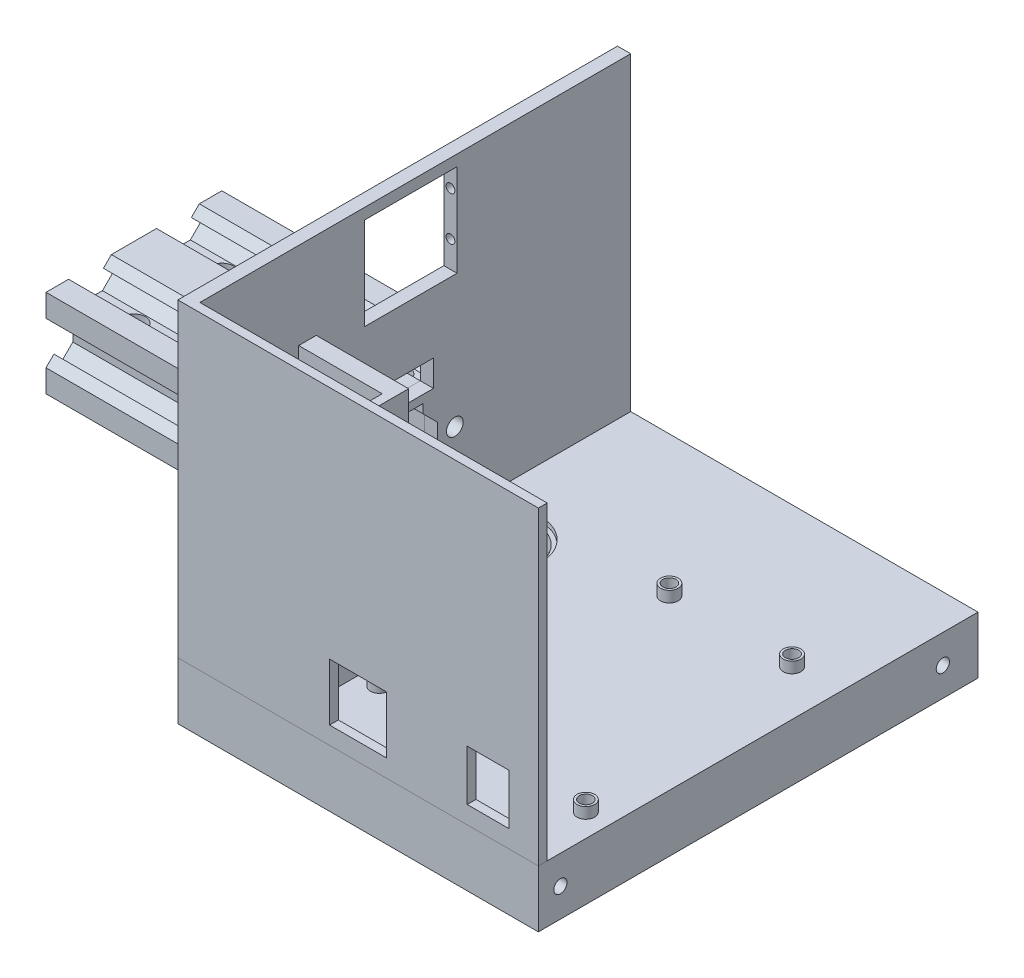
from build123d import *
from build123d.topology import SkipClean

# Parameters (mm, degrees)
SKETCH1_W                 = 60
SKETCH1_H                 = 40
BOSS_EXTRUDE1_DEPTH       = 20
SKETCH7_R                 = 1.9
CUT_EXTRUDE13_DEPTH       = 67.332495807
SKETCH16_R                = 2.6
CUT_EXTRUDE11_DEPTH       = 39.642075514
SKETCH17_W                = 100
SKETCH17_H                = 43.5
SKETCH17_H_2              = 40
BOSS_EXTRUDE2_DEPTH       = 82
SKETCH18_W                = 79
SKETCH18_H                = 98
CUT_EXTRUDE14_DEPTH       = 70.5
CUT_EXTRUDE15_REACH       = 117.136
SKETCH7_6_R               = 1.9
CUT_EXTRUDE16_REACH       = 117.136
SKETCH20_W                = 10.268679656
SKETCH20_H                = 6
CUT_EXTRUDE17_REACH       = 117.136
SKETCH22_W                = 21
SKETCH22_H                = 21
SKETCH23_R                = 1
CUT_EXTRUDE18_DEPTH       = 5
SKETCH26_W                = 26.48
SKETCH26_H                = 50.768519815
BOSS_EXTRUDE3_DEPTH       = 21
SKETCH27_W                = 19
SKETCH27_H                = 22.48
CUT_EXTRUDE19_DEPTH       = 50.768519815
CUT_EXTRUDE20_REACH       = 149.28
SKETCH30_W                = 12
SKETCH30_H                = 23.5
SKETCH30_R                = 1.5
CUT_EXTRUDE21_START       = -12
CUT_EXTRUDE21_OUTLINE_R   = 1.5
CUT_EXTRUDE21_DEPTH       = 5
SKETCH35_W                = 13
SKETCH35_H                = 13
SKETCH35_W_2              = 9.5
SKETCH35_H_2              = 11.5
CUT_EXTRUDE23_DEPTH       = 162.803121107
SKETCH45_R                = 8.1
CUT_EXTRUDE24_DEPTH       = 142.471728624
SKETCH46_R                = 9.05
CUT_EXTRUDE25_DEPTH       = 1
CUT_EXTRUDE26_START       = -9
CUT_EXTRUDE26_DEPTH       = 9
BOSS_EXTRUDE5_DEPTH       = 9
CUT_EXTRUDE27_REACH       = 118.569
SKETCH50_W                = 8.5
SKETCH50_H                = 3.5
SKETCH51_R                = 1.5
CUT_EXTRUDE28_DEPTH       = 5
SKETCH52_R                = 1.5
CUT_EXTRUDE29_DEPTH       = 5
BOSS_EXTRUDE4_START       = -7
BOSS_EXTRUDE4_OUTLINE_R   = 2
BOSS_EXTRUDE4_OUTLINE_R_2 = 1.5
BOSS_EXTRUDE4_DEPTH       = 2.5


# Read off the part's stored shape, not the designer's step: Cut-Extrude21, Boss-Extrude4
with BuildPart() as part:
    # Sketch1 → Boss-Extrude1 (new body)
    with BuildSketch(Plane(origin=(0, 0, 0), x_dir=(1, 0, 0), z_dir=(0, 1, 0))):
        Rectangle(SKETCH1_W, SKETCH1_H)
    extrude(amount=BOSS_EXTRUDE1_DEPTH)

    # Sketch7 → Cut-Extrude13 (cut, through all)
    with BuildSketch(Plane(origin=(30, 0, 0), x_dir=(0, 0, -1), z_dir=(1, 0, 0))):
        Polygon((-12.839339828, 13.9), (-7.159339828, 13.9), (-4.499339828, 16.56), (-4.499339828, 18.2), (-6.934339828, 18.2), (-5.134339828, 20), (-14.864339828, 20), (-13.064339828, 18.2), (-15.499339828, 18.2), (-15.499339828, 16.56), align=None)
        Polygon((-18.2, 13.064339828), (-20, 14.864339828), (-20, 5.134339828), (-18.2, 6.934339828), (-18.2, 4.499339828), (-16.56, 4.499339828), (-13.9, 7.159339828), (-13.9, 12.839339828), (-16.56, 15.499339828), (-18.2, 15.499339828), align=None)
        Polygon((-13.064339828, 1.798679656), (-14.863019485, 0), (-5.135660172, 0), (-6.934339828, 1.798679656), (-4.499339828, 1.798679656), (-4.499339828, 3.438679656), (-7.159339828, 6.098679656), (-12.839339828, 6.098679656), (-15.499339828, 3.438679656), (-15.499339828, 1.798679656), align=None)
        Polygon((6.098679656, 12.839339828), (6.098679656, 7.159339828), (2.73, 3.790660172), (2.73, 1.798679656), (-2.73, 1.798679656), (-2.73, 3.790660172), (-6.098679656, 7.159339828), (-6.098679656, 12.839339828), (-2.73, 16.208019485), (-2.73, 18.2), (2.73, 18.2), (2.73, 16.208019485), align=None)
        Polygon((5.135660172, 0), (14.863019485, 0), (13.064339828, 1.798679656), (15.499339828, 1.798679656), (15.499339828, 3.438679656), (12.839339828, 6.098679656), (7.159339828, 6.098679656), (4.499339828, 3.438679656), (4.499339828, 1.798679656), (6.934339828, 1.798679656), align=None)
        Polygon((20, 5.134339828), (20, 14.864339828), (18.2, 13.064339828), (18.2, 15.499339828), (16.56, 15.499339828), (13.9, 12.839339828), (13.9, 7.159339828), (16.56, 4.499339828), (18.2, 4.499339828), (18.2, 6.934339828), align=None)
        Polygon((14.864339828, 20), (5.134339828, 20), (6.934339828, 18.2), (4.499339828, 18.2), (4.499339828, 16.56), (7.159339828, 13.9), (12.839339828, 13.9), (15.499339828, 16.56), (15.499339828, 18.2), (13.064339828, 18.2), align=None)
        with Locations((-10, 10)):
            Circle(SKETCH7_R)
        with Locations((10, 10)):
            Circle(SKETCH7_R)
    extrude(amount=-CUT_EXTRUDE13_DEPTH, mode=Mode.SUBTRACT)

    # Sketch16 → Cut-Extrude11 (cut, through all)
    with BuildSketch(Plane(origin=(0, 13.9, 0), x_dir=(1, 0, 0), z_dir=(0, 1, 0))):
        with Locations(Location((20, -9.999339828, 0), (0, 0, 270))):
            Circle(SKETCH16_R)
        with Locations(Location((20, 9.999339828, 0), (0, 0, 270))):
            Circle(SKETCH16_R)
    cut_extrude11 = extrude(amount=-CUT_EXTRUDE11_DEPTH, mode=Mode.SUBTRACT)

    # Mirror1: Cut-Extrude11 across plane
    add(cut_extrude11.mirror(Plane.ZY), mode=Mode.SUBTRACT)

    # Sketch17 → Boss-Extrude2 (add)
    with BuildSketch(Plane(origin=(30, 0, 0), x_dir=(0, 0, -1), z_dir=(1, 0, 0))):
        with Locations((0, 41.75)):
            Rectangle(SKETCH17_W, SKETCH17_H)
        Rectangle(SKETCH17_W, SKETCH17_H_2)
    extrude(amount=BOSS_EXTRUDE2_DEPTH)

    # Sketch18 → Cut-Extrude14 (cut)
    with BuildSketch(Plane(origin=(0, 63.5, 0), x_dir=(1, 0, 0), z_dir=(0, 1, 0))):
        with Locations((72.5, 1)):
            Rectangle(SKETCH18_W, SKETCH18_H)
    extrude(amount=-CUT_EXTRUDE14_DEPTH, mode=Mode.SUBTRACT)

    # Sketch7<6> → Cut-Extrude15 (cut, up to next)
    with BuildSketch(Plane(origin=(30, 0, 0), x_dir=(0, 0, -1), z_dir=(1, 0, 0)), mode=Mode.PRIVATE) as cut_extrude15_sk1:
        Polygon((6.098679656, 12.839339828), (6.098679656, 7.159339828), (2.73, 3.790660172), (2.73, 1.798679656), (-2.73, 1.798679656), (-2.73, 3.790660172), (-6.098679656, 7.159339828), (-6.098679656, 12.839339828), (-2.73, 16.208019485), (-2.73, 18.2), (2.73, 18.2), (2.73, 16.208019485), align=None)
    cut_extrude15_tool1 = extrude(cut_extrude15_sk1.sketch, amount=CUT_EXTRUDE15_REACH, mode=Mode.PRIVATE) & part.part
    # Sketch7<6> → Cut-Extrude15 (cut, up to next)
    with BuildSketch(Plane(origin=(30, 0, 0), x_dir=(0, 0, -1), z_dir=(1, 0, 0)), mode=Mode.PRIVATE) as cut_extrude15_sk2:
        with Locations((-10, 10)):
            Circle(SKETCH7_6_R)
    cut_extrude15_tool2 = extrude(cut_extrude15_sk2.sketch, amount=CUT_EXTRUDE15_REACH, mode=Mode.PRIVATE) & part.part
    # Sketch7<6> → Cut-Extrude15 (cut, up to next)
    with BuildSketch(Plane(origin=(30, 0, 0), x_dir=(0, 0, -1), z_dir=(1, 0, 0)), mode=Mode.PRIVATE) as cut_extrude15_sk3:
        with Locations((10, 10)):
            Circle(SKETCH7_6_R)
    cut_extrude15_tool3 = extrude(cut_extrude15_sk3.sketch, amount=CUT_EXTRUDE15_REACH, mode=Mode.PRIVATE) & part.part
    add(cut_extrude15_tool1.solids().sort_by_distance((30, 9.99934, 0))[0], mode=Mode.SUBTRACT)
    add(cut_extrude15_tool2.solids().sort_by_distance((30, 10, 10))[0], mode=Mode.SUBTRACT)
    add(cut_extrude15_tool3.solids().sort_by_distance((30, 10, -10))[0], mode=Mode.SUBTRACT)

    # Sketch20 → Cut-Extrude16 (cut, up to next)
    with BuildSketch(Plane.ZY.offset(-30), mode=Mode.PRIVATE) as cut_extrude16_sk1:
        with Locations((0, 23)):
            Rectangle(SKETCH20_W, SKETCH20_H)
    cut_extrude16_tool1 = extrude(cut_extrude16_sk1.sketch, amount=-CUT_EXTRUDE16_REACH, mode=Mode.PRIVATE) & part.part
    add(cut_extrude16_tool1.solids().sort_by_distance((30, 23, 0))[0], mode=Mode.SUBTRACT)

    # Sketch22 → Cut-Extrude17 (cut, up to next)
    with BuildSketch(Plane.ZY.offset(-30), mode=Mode.PRIVATE) as cut_extrude17_sk1:
        with Locations((0, 50.5)):
            Rectangle(SKETCH22_W, SKETCH22_H)
    cut_extrude17_tool1 = extrude(cut_extrude17_sk1.sketch, amount=-CUT_EXTRUDE17_REACH, mode=Mode.PRIVATE) & part.part
    add(cut_extrude17_tool1.solids().sort_by_distance((30, 50.5, 0))[0], mode=Mode.SUBTRACT)

    # Sketch23 → Cut-Extrude18 (cut)
    with BuildSketch(Plane.XY.offset(-10.5)):
        with Locations((31.5, 56)):
            Circle(SKETCH23_R)
        with Locations((31.5, 46)):
            Circle(SKETCH23_R)
    extrude(amount=-CUT_EXTRUDE18_DEPTH, mode=Mode.SUBTRACT)

    # Sketch26 → Boss-Extrude3 (add)
    with BuildSketch(Plane(origin=(33, 0, 0), x_dir=(0, 0, -1), z_dir=(1, 0, 0))):
        with Locations((-34.76, 18.384259908)):
            Rectangle(SKETCH26_W, SKETCH26_H)
    extrude(amount=BOSS_EXTRUDE3_DEPTH)

    # Sketch27 → Cut-Extrude19 (cut)
    with BuildSketch(Plane(origin=(0, 43.768519815, 0), x_dir=(1, 0, 0), z_dir=(0, 1, 0))):
        with Locations((42.5, -36.76)):
            Rectangle(SKETCH27_W, SKETCH27_H)
    extrude(amount=-CUT_EXTRUDE19_DEPTH, mode=Mode.SUBTRACT)

    # Sketch30 → Cut-Extrude20 (cut, up to next)
    with BuildSketch(Plane(origin=(0, 0, 21.52), x_dir=(-1, 0, 0), z_dir=(0, 0, -1)), mode=Mode.PRIVATE) as cut_extrude20_sk1:
        with Locations((-45, 15.849339828)):
            Rectangle(SKETCH30_W, SKETCH30_H)
    cut_extrude20_tool1 = extrude(cut_extrude20_sk1.sketch, amount=-CUT_EXTRUDE20_REACH, mode=Mode.PRIVATE) & part.part
    # Sketch30 → Cut-Extrude20 (cut, up to next)
    with BuildSketch(Plane(origin=(0, 0, 21.52), x_dir=(-1, 0, 0), z_dir=(0, 0, -1)), mode=Mode.PRIVATE) as cut_extrude20_sk2:
        with Locations((-45, 29.599339828)):
            Circle(SKETCH30_R)
    cut_extrude20_tool2 = extrude(cut_extrude20_sk2.sketch, amount=-CUT_EXTRUDE20_REACH, mode=Mode.PRIVATE) & part.part
    # Sketch30 → Cut-Extrude20 (cut, up to next)
    with BuildSketch(Plane(origin=(0, 0, 21.52), x_dir=(-1, 0, 0), z_dir=(0, 0, -1)), mode=Mode.PRIVATE) as cut_extrude20_sk3:
        with Locations((-45, 2.099339828)):
            Circle(SKETCH30_R)
    cut_extrude20_tool3 = extrude(cut_extrude20_sk3.sketch, amount=-CUT_EXTRUDE20_REACH, mode=Mode.PRIVATE) & part.part
    add(cut_extrude20_tool1.solids().sort_by_distance((45, 15.84934, 21.52))[0], mode=Mode.SUBTRACT)
    add(cut_extrude20_tool2.solids().sort_by_distance((45, 29.59934, 21.52))[0], mode=Mode.SUBTRACT)
    add(cut_extrude20_tool3.solids().sort_by_distance((45, 2.09934, 21.52))[0], mode=Mode.SUBTRACT)

    # Cut-Extrude21 outline → Cut-Extrude21 (cut)
    with BuildSketch(Plane(origin=(0, 0, 0), x_dir=(1, 0, 0), z_dir=(0, 1, 0)).offset(CUT_EXTRUDE21_START)):
        with Locations((101.6, 18.1)):
            Circle(CUT_EXTRUDE21_OUTLINE_R)
        with Locations((73.7, 18.1)):
            Circle(CUT_EXTRUDE21_OUTLINE_R)
        with Locations((58.5, -32.7)):
            Circle(CUT_EXTRUDE21_OUTLINE_R)
        with Locations((106.8, -34)):
            Circle(CUT_EXTRUDE21_OUTLINE_R)
    extrude(amount=CUT_EXTRUDE21_DEPTH, mode=Mode.SUBTRACT)

    # Sketch35 → Cut-Extrude23 (cut, through all)
    with BuildSketch(Plane(origin=(0, 0, 48), x_dir=(-1, 0, 0), z_dir=(0, 0, -1))):
        with Locations((-71, 3.5)):
            Rectangle(SKETCH35_W, SKETCH35_H)
        with Locations((-100.55, 2.75)):
            Rectangle(SKETCH35_W_2, SKETCH35_H_2)
    extrude(amount=-CUT_EXTRUDE23_DEPTH, mode=Mode.SUBTRACT)

    # Sketch45 → Cut-Extrude24 (cut, through all)
    with BuildSketch(Plane(origin=(0, -7, 0), x_dir=(1, 0, 0), z_dir=(0, 1, 0))):
        with Locations(Location((43.4696408, -10, 0), (0, 0, 270))):
            Circle(SKETCH45_R)
        with Locations(Location((43.4696408, 10, 0), (0, 0, 270))):
            Circle(SKETCH45_R)
    extrude(amount=-CUT_EXTRUDE24_DEPTH, mode=Mode.SUBTRACT)

    # Sketch46 → Cut-Extrude25 (cut)
    with BuildSketch(Plane(origin=(0, -7, 0), x_dir=(1, 0, 0), z_dir=(0, 1, 0))):
        with Locations(Location((43.4696408, -10, 0), (0, 0, 270))):
            Circle(SKETCH46_R)
        with Locations(Location((43.4696408, 10, 0), (0, 0, 270))):
            Circle(SKETCH46_R)
    extrude(amount=-CUT_EXTRUDE25_DEPTH, mode=Mode.SUBTRACT)

    # Sketch49 → Cut-Extrude26 (cut)
    with BuildSketch(Plane(origin=(0, -20, 0), x_dir=(-1, 0, 0), z_dir=(0, -1, 0)).offset(CUT_EXTRUDE26_START)):
        with BuildLine():
            ThreePointArc((-50.65780607, 13.733668444), (-42.703757211, 18.063710209), (-35.707105503, 12.313665008))
            Line((-35.707105503, 12.313665008), (-33.569233109, 13.787073746))
            ThreePointArc((-33.569233109, 13.787073746), (-42.467373387, 20.552509656), (-52.480068064, 15.58320701))
            Line((-52.480068064, 15.58320701), (-50.65780607, 13.733668444))
        make_face()
    cut_extrude26 = extrude(amount=CUT_EXTRUDE26_DEPTH, mode=Mode.SUBTRACT)

    # Sketch53 → Boss-Extrude5 (add)
    with BuildSketch(Plane.XZ.offset(11)):
        with BuildLine():
            Line((49.137096023, -18.957675552), (47.328329292, -17.121834252))
            ThreePointArc((47.328329292, -17.121834252), (43.472913007, -18.099999339), (39.616707669, -17.124949564))
            Line((39.616707669, -17.124949564), (38.427530776, -19.324008071))
            ThreePointArc((38.427530776, -19.324008071), (43.832013582, -20.593804131), (49.137096023, -18.957675552))
        make_face()
    boss_extrude5 = extrude(amount=BOSS_EXTRUDE5_DEPTH)

    # Mirror2: Cut-Extrude26, Boss-Extrude5 across plane
    with SkipClean():  # the faces are left unmerged after this step: merging them gives an invalid solid
        add(cut_extrude26.mirror(Plane(origin=(0, 0, 0), x_dir=(1, 0, 0), z_dir=(0, 0, -1))), mode=Mode.SUBTRACT)
        add(boss_extrude5.mirror(Plane(origin=(0, 0, 0), x_dir=(1, 0, 0), z_dir=(0, 0, -1))))

    # Sketch50 → Cut-Extrude27 (cut, up to next)
    with BuildSketch(Plane(origin=(54, 0, 0), x_dir=(0, 0, -1), z_dir=(1, 0, 0)), mode=Mode.PRIVATE) as cut_extrude27_sk1:
        with Locations((-34.76, 38.768519815)):
            Rectangle(SKETCH50_W, SKETCH50_H)
    cut_extrude27_tool1 = extrude(cut_extrude27_sk1.sketch, amount=-CUT_EXTRUDE27_REACH, mode=Mode.PRIVATE) & part.part
    add(cut_extrude27_tool1.solids().sort_by_distance((54, 38.76852, 34.76))[0], mode=Mode.SUBTRACT)

    # Sketch51 → Cut-Extrude28 (cut)
    with SkipClean():  # the faces are left unmerged after this step: merging them gives an invalid solid
        with BuildSketch(Plane(origin=(112, 0, 0), x_dir=(0, 0, -1), z_dir=(1, 0, 0))):
            with Locations((-45, -13.5)):
                Circle(SKETCH51_R)
            with Locations((42, -13.5)):
                Circle(SKETCH51_R)
        extrude(amount=-CUT_EXTRUDE28_DEPTH, mode=Mode.SUBTRACT)

    # Sketch52 → Cut-Extrude29 (cut)
    with SkipClean():  # the faces are left unmerged after this step: merging them gives an invalid solid
        with BuildSketch(Plane(origin=(0, 0, -50), x_dir=(-1, 0, 0), z_dir=(0, 0, -1))):
            with Locations(Location((-106, -13.5, 0), (0, 0, 90))):
                Circle(SKETCH52_R)
            with Locations(Location((-36, -13.5, 0), (0, 0, 90))):
                Circle(SKETCH52_R)
        extrude(amount=-CUT_EXTRUDE29_DEPTH, mode=Mode.SUBTRACT)

    # Boss-Extrude4 outline → Boss-Extrude4 (add)
    # profile 1 of 4: a face of its own
    with SkipClean():  # the faces are left unmerged after this step: merging them gives an invalid solid
        with BuildSketch(Plane(origin=(0, 0, 0), x_dir=(1, 0, 0), z_dir=(0, 1, 0)).offset(BOSS_EXTRUDE4_START)):
            with Locations((106.8, -34)):
                Circle(BOSS_EXTRUDE4_OUTLINE_R)
            with Locations((106.8, -34)):
                Circle(BOSS_EXTRUDE4_OUTLINE_R_2, mode=Mode.SUBTRACT)
        # profile 2 of 4: a face of its own
        with BuildSketch(Plane(origin=(0, 0, 0), x_dir=(1, 0, 0), z_dir=(0, 1, 0)).offset(BOSS_EXTRUDE4_START)):
            with Locations((58.5, -32.7)):
                Circle(BOSS_EXTRUDE4_OUTLINE_R)
            with Locations((58.5, -32.7)):
                Circle(BOSS_EXTRUDE4_OUTLINE_R_2, mode=Mode.SUBTRACT)
        # profile 3 of 4: a face of its own
        with BuildSketch(Plane(origin=(0, 0, 0), x_dir=(1, 0, 0), z_dir=(0, 1, 0)).offset(BOSS_EXTRUDE4_START)):
            with Locations((101.6, 18.1)):
                Circle(BOSS_EXTRUDE4_OUTLINE_R)
            with Locations((101.6, 18.1)):
                Circle(BOSS_EXTRUDE4_OUTLINE_R_2, mode=Mode.SUBTRACT)
        # profile 4 of 4: a face of its own
        with BuildSketch(Plane(origin=(0, 0, 0), x_dir=(1, 0, 0), z_dir=(0, 1, 0)).offset(BOSS_EXTRUDE4_START)):
            with Locations((73.7, 18.1)):
                Circle(BOSS_EXTRUDE4_OUTLINE_R)
            with Locations((73.7, 18.1)):
                Circle(BOSS_EXTRUDE4_OUTLINE_R_2, mode=Mode.SUBTRACT)
        extrude(amount=BOSS_EXTRUDE4_DEPTH)


with BuildPart() as body_2:
    # Split1: the piece on the far side of the plane
    add(part.part)
    split(bisect_by=Plane(origin=(30, 0, 0), x_dir=(0, 0, -1), z_dir=(-1, 0, 0)), keep=Keep.BOTTOM)


with BuildPart() as part_1:
    add(part.part)

    # Split1
    split(bisect_by=Plane(origin=(30, 0, 0), x_dir=(0, 0, -1), z_dir=(-1, 0, 0)), keep=Keep.TOP)


with BuildPart() as body_3:
    # Split3: the piece on the far side of the plane
    add(body_2.part)
    split(bisect_by=Plane.ZX.offset(-7), keep=Keep.BOTTOM)


with BuildPart() as body_2_1:
    add(body_2.part)

    # Split3
    split(bisect_by=Plane.ZX.offset(-7), keep=Keep.TOP)


solid = Compound([part_1.part, body_3.part, body_2_1.part])
